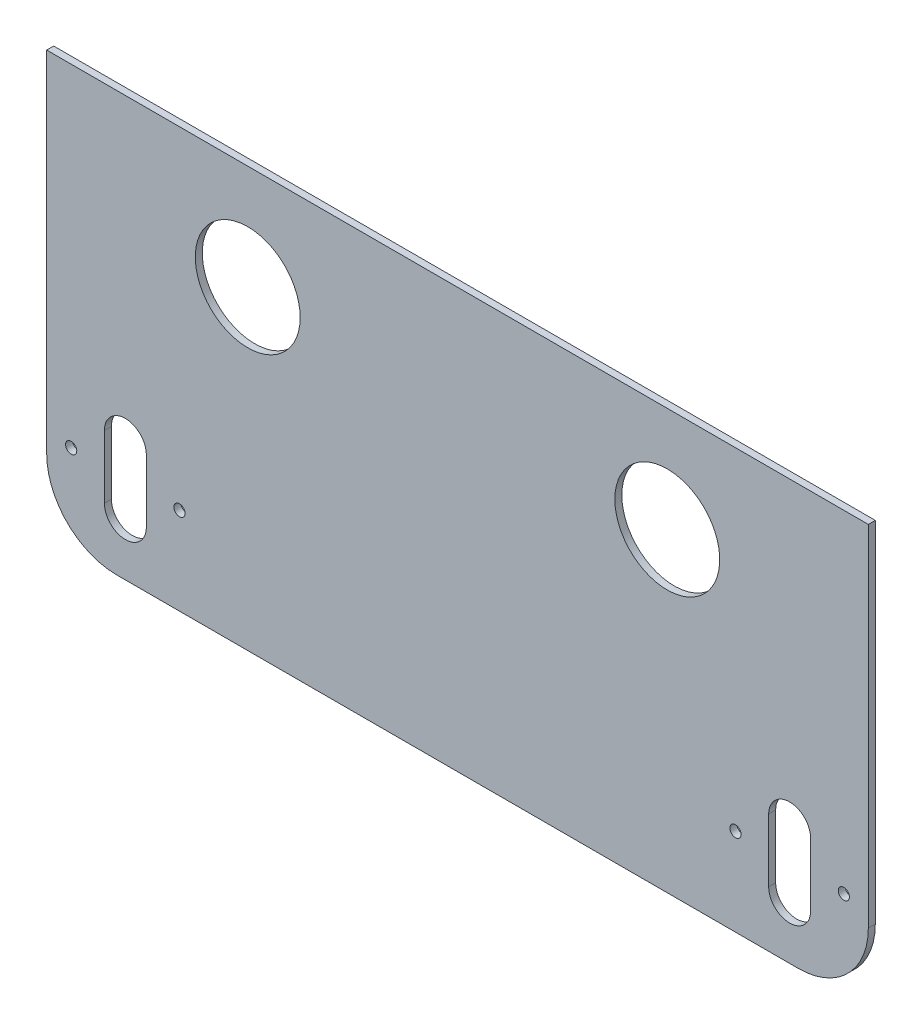
from build123d import *

# Parameters (mm, degrees)
SKETCH_1_W          = 235
SKETCH_1_H          = 120
SKETCH_1_R          = 15
EXTRUDE_1_DEPTH     = 2
FILLET_1_R          = 20
FILLET_2_R          = 20
SKETCH_3_R          = 1.6
CUT_EXTRUDE_1_DEPTH = 10


with BuildPart() as part:
    # 草图1 → 凸台-拉伸1 (new body)
    with BuildSketch(Plane.XY):
        with Locations((43.291102509, -15.293659776)):
            Rectangle(SKETCH_1_W, SKETCH_1_H)
        with Locations((-16.708897491, 14.706340224)):
            Circle(SKETCH_1_R, mode=Mode.SUBTRACT)
        with Locations((103.291102509, 14.706340224)):
            Circle(SKETCH_1_R, mode=Mode.SUBTRACT)
    extrude(amount=EXTRUDE_1_DEPTH)

    # 圆角1
    fillet_1_edges = [part.edges().sort_by_distance(p)[0] for p in [
        (160.791102509, -75.293659776, 1),
    ]]
    fillet(fillet_1_edges, radius=FILLET_1_R)

    # 圆角2
    fillet_2_edges = [part.edges().sort_by_distance(p)[0] for p in [
        (-74.208897491, -75.293659776, 1),
    ]]
    fillet(fillet_2_edges, radius=FILLET_2_R)

    # 草图3 → 切除-拉伸1 (cut)
    with BuildSketch(Plane.XY.offset(2)):
        with Locations((-36.208897491, -50.293659776)):
            Circle(SKETCH_3_R)
        with Locations((-67.208897491, -50.293659776)):
            Circle(SKETCH_3_R)
        with Locations((153.791102509, -50.293659776)):
            Circle(SKETCH_3_R)
        with Locations((122.791102509, -50.293659776)):
            Circle(SKETCH_3_R)
        with BuildLine():
            Line((-57.708897491, -59.293659776), (-57.708897491, -41.293659776))
            ThreePointArc((-57.708897491, -41.293659776), (-51.708897491, -35.293659776), (-45.708897491, -41.293659776))
            Line((-45.708897491, -41.293659776), (-45.708897491, -59.293659776))
            ThreePointArc((-45.708897491, -59.293659776), (-51.708897491, -65.293659776), (-57.708897491, -59.293659776))
        make_face()
        with BuildLine():
            Line((144.291102509, -59.293659776), (144.291102509, -41.293659776))
            ThreePointArc((144.291102509, -41.293659776), (138.291102509, -35.293659776), (132.291102509, -41.293659776))
            Line((132.291102509, -41.293659776), (132.291102509, -59.293659776))
            ThreePointArc((132.291102509, -59.293659776), (138.291102509, -65.293659776), (144.291102509, -59.293659776))
        make_face()
    extrude(amount=-CUT_EXTRUDE_1_DEPTH, mode=Mode.SUBTRACT)


solid = part.part
